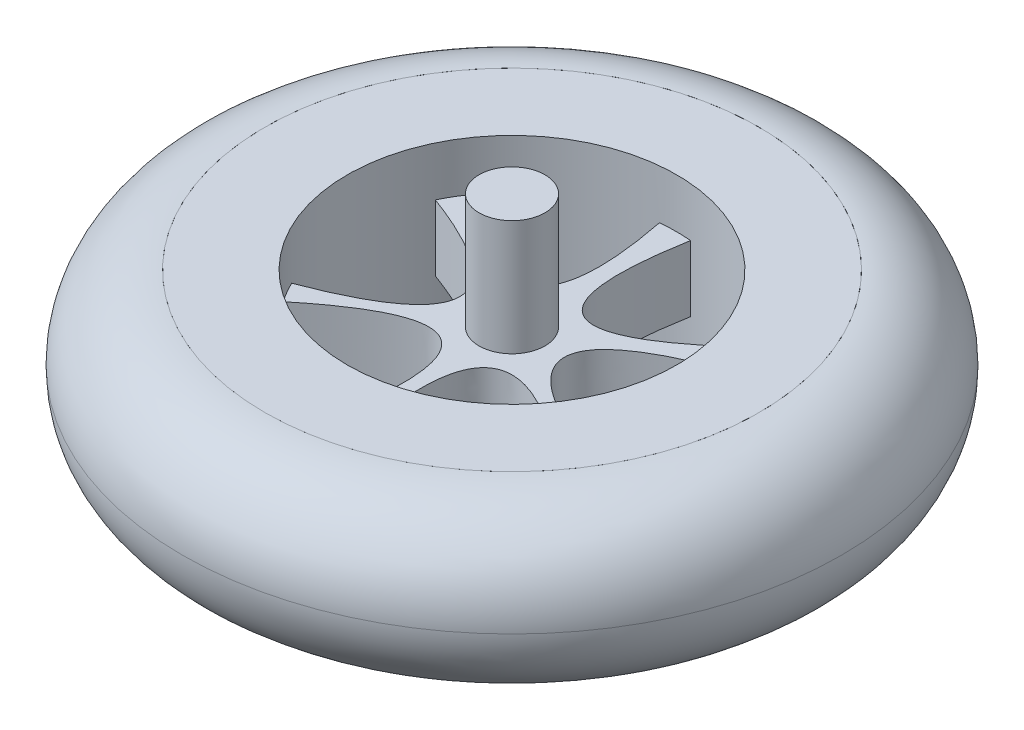
from build123d import *

# Parameters (mm, degrees)
CROQUIS1_R              = 15
SALIENTE_EXTRUIR2_DEPTH = 5
CROQUIS3_R              = 10
CORTAR_EXTRUIR2_DEPTH   = 3
CORTAR_EXTRUIR3_DEPTH   = 22.424285286
CROQUIS5_R              = 2
SALIENTE_EXTRUIR3_DEPTH = 7
CROQUIS7_W              = 5
CROQUIS7_H              = 10
REDONDEO1_R             = 5


with BuildPart() as part:
    # Croquis1 → Saliente-Extruir2 (new body)
    with BuildSketch(Plane(origin=(0, 0, 0), x_dir=(1, 0, 0), z_dir=(0, 1, 0))):
        with Locations(Location((0, 0, 0), (0, 0, 270))):
            Circle(CROQUIS1_R)
    saliente_extruir2 = extrude(amount=SALIENTE_EXTRUIR2_DEPTH)

    # Croquis3 → Cortar-Extruir2 (cut)
    with BuildSketch(Plane(origin=(0, 5, 0), x_dir=(1, 0, 0), z_dir=(0, 1, 0))):
        with Locations(Location((0, 0, 0), (0, 0, 270))):
            Circle(CROQUIS3_R)
    cortar_extruir2 = extrude(amount=-CORTAR_EXTRUIR2_DEPTH, mode=Mode.SUBTRACT)

    # Croquis4 → Cortar-Extruir3 (cut, through all)
    with BuildSketch(Plane(origin=(0, 2, 0), x_dir=(1, 0, 0), z_dir=(0, 1, 0))):
        with BuildLine():
            ThreePointArc((-1.001232744, 9.949750398), (-5.117300948, 8.591462681), (-8.271983717, 5.619100051))
            add(Edge.make_bspline(
                [(-1.001232744, 9.949750398), (1.430484014, -2.293091289), (-8.271983717, 5.619100051)],
                knots=[0, 0, 0, 1, 1, 1], degree=2))
        make_face()
        with BuildLine():
            ThreePointArc((-9.002390435, 4.35395986), (-9.999982138, -0.018900569), (-8.985867682, -4.387958751))
            add(Edge.make_bspline(
                [(-9.002390435, 4.35395986), (2.63491032, 0.012659736), (-8.985867682, -4.387958751)],
                knots=[0, 0, 0, 1, 1, 1], degree=2))
        make_face()
        with BuildLine():
            ThreePointArc((8.050031428, 5.932705454), (4.897058005, 8.718877387), (0.877109656, 9.961459665))
            add(Edge.make_bspline(
                [(8.050031428, 5.932705454), (-1.306582901, -2.427210179), (0.877109656, 9.961459665)],
                knots=[0, 0, 0, 1, 1, 1], degree=2))
        make_face()
        with BuildLine():
            ThreePointArc((8.985867682, -4.387958751), (9.999982138, -0.018900569), (9.002390435, 4.35395986))
            add(Edge.make_bspline(
                [(8.985867682, -4.387958751), (-2.63491918, 0.014046153), (9.002390435, 4.35395986)],
                knots=[0, 0, 0, 1, 1, 1], degree=2))
        make_face()
        with BuildLine():
            ThreePointArc((0.877109656, -9.961459665), (5.063644848, -8.623195513), (8.271983717, -5.619100051))
            add(Edge.make_bspline(
                [(0.877109656, -9.961459665), (-1.379629203, 2.292044769), (8.271983717, -5.619100051)],
                knots=[0, 0, 0, 1, 1, 1], degree=2))
        make_face()
        with BuildLine():
            ThreePointArc((-8.271983717, -5.619100051), (-4.991615636, -8.665089344), (-0.710984409, -9.974693036))
            add(Edge.make_bspline(
                [(-8.271983717, -5.619100051), (1.314994367, 2.287846827), (-0.710984409, -9.974693036)],
                knots=[0, 0, 0, 1, 1, 1], degree=2))
        make_face()
    cortar_extruir3 = extrude(amount=-CORTAR_EXTRUIR3_DEPTH, mode=Mode.SUBTRACT)

    # Croquis5 → Saliente-Extruir3 (add)
    with BuildSketch(Plane(origin=(0, 2, 0), x_dir=(1, 0, 0), z_dir=(0, 1, 0))):
        with Locations(Location((0, 0, 0), (0, 0, 270))):
            Circle(CROQUIS5_R)
    saliente_extruir3 = extrude(amount=SALIENTE_EXTRUIR3_DEPTH)

    # Simetría2: Saliente-Extruir2, Cortar-Extruir2, Cortar-Extruir3, Saliente-Extruir3 across plane
    add(saliente_extruir2.mirror(Plane.ZX))
    add(cortar_extruir2.mirror(Plane.ZX), mode=Mode.SUBTRACT)
    add(cortar_extruir3.mirror(Plane.ZX), mode=Mode.SUBTRACT)
    add(saliente_extruir3.mirror(Plane.ZX))


with BuildPart() as body_2:
    # Croquis7 → Revolución3 (revolve)
    with BuildSketch(Plane.XY, mode=Mode.PRIVATE) as revoluci_n3_sk:
        with Locations((-17.5, 0)):
            Rectangle(CROQUIS7_W, CROQUIS7_H)
    revolve(revoluci_n3_sk.sketch.rotate(Axis((0, -11.719124905, 0), (0, 1, 0)), 270), axis=Axis((0, -11.719124905, 0), (0, 1, 0)))

    # Redondeo1
    redondeo1_edges = [body_2.edges().sort_by_distance(p)[0] for p in [
        (0, -5, 20),
        (0, 5, 20),
    ]]
    fillet(redondeo1_edges, radius=REDONDEO1_R - 0.0001)  # a hair under: the kernel refuses the full size


solid = Compound([part.part, body_2.part])
